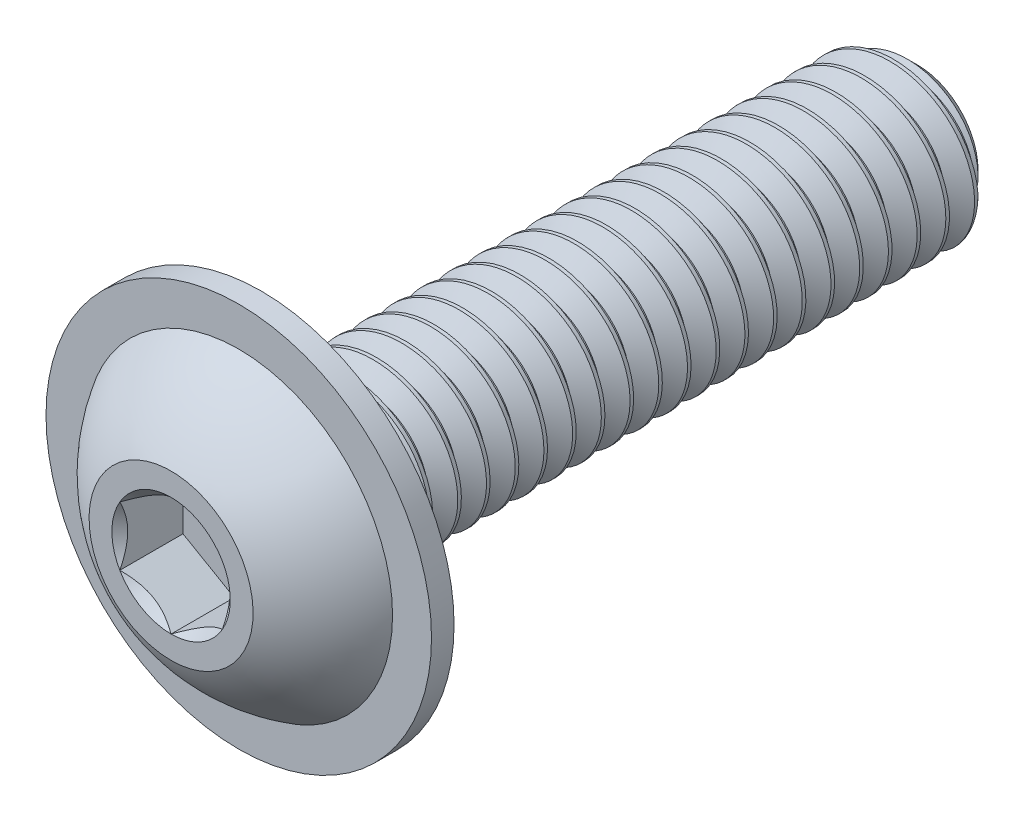
from build123d import *

# Parameters (mm, degrees)
SKETCH1_W           = 16
SKETCH1_H           = 2
CHAMFER1_SIZE       = 0.525
CUT_SWEEP1_PITCH    = 0.7
SKETCH11_R          = 4.7
BOSS_EXTRUDE3_DEPTH = 0.55
CUT_EXTRUDE2_DEPTH  = 1.54


with BuildPart() as part:
    # Sketch1 → Revolve1 (revolve)
    with BuildSketch(Plane(origin=(0, 0, 0), x_dir=(0, 0, -1), z_dir=(1, 0, 0))):
        with Locations((10.2, 1)):
            Rectangle(SKETCH1_W, SKETCH1_H)
    revolve(axis=Axis((0, 0, -18.2), (0, 0, 1)))

    # Chamfer1
    chamfer1_edges = [part.edges().sort_by_distance(p)[0] for p in [
        (0, -2, -18.2),
    ]]
    chamfer(chamfer1_edges, length=CHAMFER1_SIZE)

    # Cut-Sweep1: the profile of Sketch2 profile screwed along a right-hand helix of 23.857143 turns, 6 arcs to a turn; built about Z, then put on its axis
    cut_sweep1_z = Axis((0, 0, 0), (0, 0, 1))
    cut_sweep1_corners = [(2.0003, 0, 0.000173205), (2.0003, 0, -0.612673205), (1.545336663, 0, -0.35), (1.545336663, 0, -0.2625)]
    with BuildLine(mode=Mode.PRIVATE) as cut_sweep1_profile:
        Line(cut_sweep1_corners[0], cut_sweep1_corners[1])
        Line(cut_sweep1_corners[1], cut_sweep1_corners[2])
        Line(cut_sweep1_corners[2], cut_sweep1_corners[3])
        Line(cut_sweep1_corners[3], cut_sweep1_corners[0])
    cut_sweep1_cap = Face(cut_sweep1_profile.wire())
    cut_sweep1_turn_angles = [0, 30, 60, 90, 120, 150, 180, 210, 240, 270, 300, 330, 360]
    cut_sweep1_turn_weights = [1, 0.8660254037844387, 1, 0.8660254037844387, 1, 0.8660254037844387, 1, 0.8660254037844387, 1, 0.8660254037844387, 1, 0.8660254037844387, 1]
    cut_sweep1_turn_rails = [Edge.make_bspline([Vector(p[0], p[1], 0).rotate(cut_sweep1_z, cut_sweep1_turn_angles[k]) / cut_sweep1_turn_weights[k] + Vector(0, 0, p[2] + CUT_SWEEP1_PITCH * cut_sweep1_turn_angles[k] / 360) for k in range(13)], [0, 0, 0, 1, 1, 2, 2, 3, 3, 4, 4, 5, 5, 6, 6, 6], 2, cut_sweep1_turn_weights) for p in cut_sweep1_corners]
    cut_sweep1_turn_sides = [Face.make_surface_from_curves(cut_sweep1_turn_rails[p[0]], cut_sweep1_turn_rails[p[1]]) for p in [(0, 1), (1, 2), (2, 3), (3, 0)]]
    cut_sweep1_last_angles = [8280, 8310, 8340, 8370, 8400, 8430, 8460, 8490, 8520, 8550, 8580, 8584.285714286, 8588.571428571]
    cut_sweep1_last_weights = [1, 0.8660254037844387, 1, 0.8660254037844387, 1, 0.8660254037844387, 1, 0.8660254037844387, 1, 0.8660254037844387, 1, 0.9972037971812046, 1]
    cut_sweep1_last_rails = [Edge.make_bspline([Vector(p[0], p[1], 0).rotate(cut_sweep1_z, cut_sweep1_last_angles[k]) / cut_sweep1_last_weights[k] + Vector(0, 0, p[2] + CUT_SWEEP1_PITCH * cut_sweep1_last_angles[k] / 360) for k in range(13)], [0, 0, 0, 1, 1, 2, 2, 3, 3, 4, 4, 5, 5, 6, 6, 6], 2, cut_sweep1_last_weights) for p in cut_sweep1_corners]
    cut_sweep1_last_sides = [Face.make_surface_from_curves(cut_sweep1_last_rails[p[0]], cut_sweep1_last_rails[p[1]]) for p in [(0, 1), (1, 2), (2, 3), (3, 0)]]
    cut_sweep1 = Plane(origin=(0, 0, -18.2), x_dir=(0, 1, 0), z_dir=(0, 0, 1)) * Solid(Shell([*[p.moved(Location((0, 0, CUT_SWEEP1_PITCH * i))) for i in range(23) for p in cut_sweep1_turn_sides], *cut_sweep1_last_sides, cut_sweep1_cap, cut_sweep1_cap.rotate(cut_sweep1_z, 8588.571428571).moved(Location((0, 0, CUT_SWEEP1_PITCH * 8588.571428571 / 360)))]))
    add(cut_sweep1, mode=Mode.SUBTRACT)

    # Sketch7 → Revolve2 (revolve)
    with BuildSketch(Plane(origin=(0, 0, 0), x_dir=(0, 0, -1), z_dir=(1, 0, 0)), mode=Mode.PRIVATE) as revolve2_sk:
        with BuildLine():
            Line((1.65, 3.75), (2.2, 3.75))
            Line((2.2, 3.75), (2.2, 0))
            Line((2.2, 0), (0, 0))
            Line((0, 0), (0, 2))
            ThreePointArc((0, 2), (0.701939733, 2.991028251), (1.65, 3.75))
        make_face()
    revolve(revolve2_sk.sketch.rotate(Axis((0, 0, 0), (0, 0, -1)), 189.336081704), axis=Axis((0, 0, 0), (0, 0, -1)))

    # Sketch11 → Boss-Extrude3 (add)
    with BuildSketch(Plane(origin=(0, 0, -2.2), x_dir=(-1, 0, 0), z_dir=(0, 0, -1))):
        Circle(SKETCH11_R)
    extrude(amount=-BOSS_EXTRUDE3_DEPTH)

    # Sketch5 → Cut-Extrude2 (cut)
    with BuildSketch(Plane.XY):
        Polygon((1.25, -0.721687836), (1.25, 0.721687836), (0, 1.443375673), (-1.25, 0.721687836), (-1.25, -0.721687836), (0, -1.443375673), align=None)
    extrude(amount=-CUT_EXTRUDE2_DEPTH, mode=Mode.SUBTRACT)

    # Cut-Extrude3 cone 1 section (through the dimple's axis) → Cut-Extrude3 (revolve, cut)
    with BuildSketch(Plane(origin=(0, 0, 0), x_dir=(0, -1, 0), z_dir=(1, 0, 0))):
        Polygon((0, 0), (1.443375673, 0), (0, 1.443375673), align=None)
    revolve(axis=Axis((0, 0, 0), (0, 0, -1)), mode=Mode.SUBTRACT)


solid = part.part
